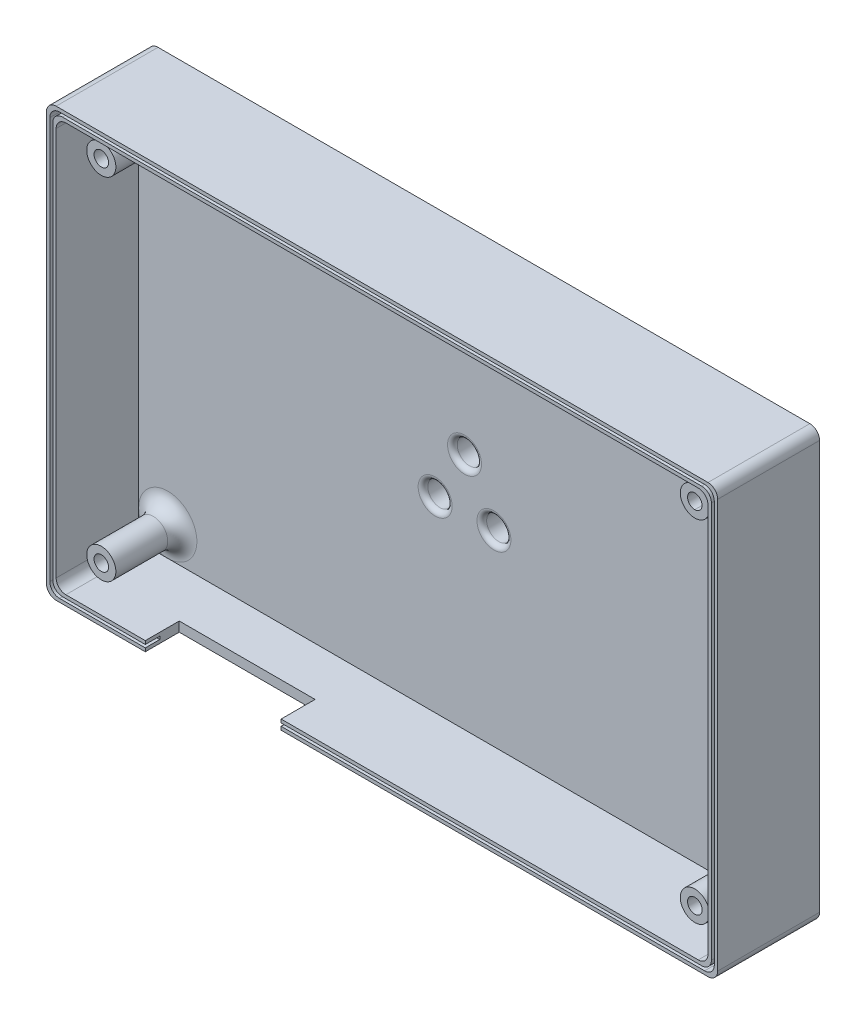
from build123d import *

# Parameters (mm, degrees)
SZKIC2_W                                   = 138.377616904
SZKIC2_H                                   = 88.232378654
DODANIE_WYCI_GNI_CIE1_DEPTH                = 4
WYTNIJ_WYCI_GNI_CIE1_DEPTH                 = 2
SZKIC4_W                                   = 138.377616904
SZKIC4_H                                   = 88.232378654
SZKIC4_W_2                                 = 134.377616904
SZKIC4_H_2                                 = 84.232378654
WYCI_GNI_CIE_CIENKA_CIANKA1_DEPTH          = 17
SZKIC2_5_R                                 = 1.492872888
SZKIC2_5_R_2                               = 1.482348965
SZKIC2_5_R_3                               = 1.507070184
WYTNIJ_WYCI_GNI_CIE3_DEPTH                 = 15
DODANIE_WYCI_GNI_CIE2_OUTLINE_R            = 3
DODANIE_WYCI_GNI_CIE2_OUTLINE_R_2          = 1.507070184
DODANIE_WYCI_GNI_CIE2_OUTLINE_R_3          = 1.492872888
DODANIE_WYCI_GNI_CIE2_DEPTH                = 13.7
SZKIC6_W                                   = 136.977616904
SZKIC6_H                                   = 86.832378654
SZKIC6_W_2                                 = 135.777616904
SZKIC6_H_2                                 = 85.632378654
WYCI_CIE_WYCI_GNI_CIE_CIENKA_CIANKA1_DEPTH = 3
ZAOKR_GLENIE1_R                            = 3
ZAOKR_GLENIE2_R                            = 2
SZKIC8_R                                   = 2.5
WYTNIJ_WYCI_GNI_CIE4_DEPTH                 = 451.2299015
DODANIE_WYCI_GNI_CIE3_START                = -4
SZKIC8_3_R                                 = 13
SZKIC8_3_R_2                               = 2.5
DODANIE_WYCI_GNI_CIE3_DEPTH                = 3
ZAOKR_GLENIE3_R                            = 1.5
ZAOKR_GLENIE4_R                            = 1
WYTNIJ_WYCI_GNI_CIE5_START                 = 10
SZKIC10_W                                  = 28
SZKIC10_H                                  = 13.675297862
WYTNIJ_WYCI_GNI_CIE5_DEPTH                 = 441.2299015


# Read off the part's stored shape, not the designer's step: Dodanie-wyciągnięcie2
with BuildPart() as part:
    # Szkic2 → Dodanie-wyciągnięcie1 (new body)
    with BuildSketch(Plane.XY):
        with Locations((-255.799797678, 267.011389153)):
            Rectangle(SZKIC2_W, SZKIC2_H)
    extrude(amount=DODANIE_WYCI_GNI_CIE1_DEPTH)

    # Szkic2<4> → Wytnij-wyciągnięcie1 (cut)
    with BuildSketch(Plane.XY):
        Polygon((-196.238801669, 233.706863015), (-193.005640162, 233.706863015), (-191.389059408, 230.906863015), (-193.005640162, 228.106863015), (-196.238801669, 228.106863015), (-197.855382423, 230.906863015), align=None)
        Polygon((-318.593699386, 305.915988479), (-320.21028014, 303.115988479), (-318.593699386, 300.315988479), (-315.360537879, 300.315988479), (-313.743957125, 303.115988479), (-315.360537879, 305.915988479), align=None)
        Polygon((-318.593699386, 233.706863015), (-320.21028014, 230.906863015), (-318.593699386, 228.106863015), (-315.360537879, 228.106863015), (-313.743957125, 230.906863015), (-315.360537879, 233.706863015), align=None)
        Polygon((-196.238801669, 305.915988479), (-193.005640162, 305.915988479), (-191.389059408, 303.115988479), (-193.005640162, 300.315988479), (-196.238801669, 300.315988479), (-197.855382423, 303.115988479), align=None)
    extrude(amount=WYTNIJ_WYCI_GNI_CIE1_DEPTH, mode=Mode.SUBTRACT)

    # Szkic4 → Wyciągnięcie-cienka ścianka1 (add)
    with BuildSketch(Plane.XY.offset(4)):
        with Locations((-255.799797678, 267.011389153)):
            Rectangle(SZKIC4_W, SZKIC4_H)
        with Locations((-255.799797678, 267.011389153)):
            Rectangle(SZKIC4_W_2, SZKIC4_H_2, mode=Mode.SUBTRACT)
    extrude(amount=WYCI_GNI_CIE_CIENKA_CIANKA1_DEPTH)

    # Szkic2<5> → Wytnij-wyciągnięcie3 (cut)
    with BuildSketch(Plane.XY):
        with Locations(Location((-316.977118633, 303.115988479, 0), (0, 0, 180))):
            Circle(SZKIC2_5_R)
        with Locations(Location((-316.977118633, 230.906863015, 0), (0, 0, 180))):
            Circle(SZKIC2_5_R_2)
        with Locations(Location((-194.622725918, 230.906863015, 0), (0, 0, 180))):
            Circle(SZKIC2_5_R_3)
        with Locations(Location((-194.622220915, 303.115988479, 0), (0, 0, 180))):
            Circle(SZKIC2_5_R)
    extrude(amount=WYTNIJ_WYCI_GNI_CIE3_DEPTH, mode=Mode.SUBTRACT)

    # Dodanie-wyciągnięcie2 outline → Dodanie-wyciągnięcie2 (add)
    # profile 1 of 4: a face of its own
    with BuildSketch(Plane.XY.offset(4)):
        with Locations((-194.622476723, 230.906789826)):
            Circle(DODANIE_WYCI_GNI_CIE2_OUTLINE_R)
        with Locations((-194.622725918, 230.906863015)):
            Circle(DODANIE_WYCI_GNI_CIE2_OUTLINE_R_2, mode=Mode.SUBTRACT)
    # profile 2 of 4: a face of its own
    with BuildSketch(Plane.XY.offset(4)):
        with Locations((-194.622476723, 303.115988479)):
            Circle(DODANIE_WYCI_GNI_CIE2_OUTLINE_R)
        with BuildLine():
            ThreePointArc((-194.622348819, 304.608861362), (-193.129348027, 303.115988479), (-194.622348819, 301.623115596))
            ThreePointArc((-194.622348819, 301.623115596), (-196.115349611, 303.11598848), (-194.622348819, 304.608861362))
        make_face(mode=Mode.SUBTRACT)
    # profile 3 of 4: a face of its own
    with BuildSketch(Plane.XY.offset(4)):
        with Locations((-316.977118633, 303.115988479)):
            Circle(DODANIE_WYCI_GNI_CIE2_OUTLINE_R)
        with Locations((-316.977118633, 303.115988479)):
            Circle(DODANIE_WYCI_GNI_CIE2_OUTLINE_R_3, mode=Mode.SUBTRACT)
    # profile 4 of 4: a face of its own
    with BuildSketch(Plane.XY.offset(4)):
        with Locations((-316.977118633, 230.906789826)):
            Circle(DODANIE_WYCI_GNI_CIE2_OUTLINE_R)
        with Locations((-316.977118633, 230.906789826)):
            Circle(DODANIE_WYCI_GNI_CIE2_OUTLINE_R_3, mode=Mode.SUBTRACT)
    extrude(amount=DODANIE_WYCI_GNI_CIE2_DEPTH)

    # Szkic6 → Wycięcie-wyciągnięcie-cienka ścianka1 (cut)
    with BuildSketch(Plane.XY.offset(21)):
        with Locations((-255.799797678, 267.011389153)):
            Rectangle(SZKIC6_W, SZKIC6_H)
        with Locations((-255.799797678, 267.011389153)):
            Rectangle(SZKIC6_W_2, SZKIC6_H_2, mode=Mode.SUBTRACT)
    extrude(amount=-WYCI_CIE_WYCI_GNI_CIE_CIENKA_CIANKA1_DEPTH, mode=Mode.SUBTRACT)

    # Zaokrąglenie1
    zaokr_glenie1_edges = [part.edges().sort_by_distance(p)[0] for p in [
        (-319.977118633, 303.115988479, 4),
        (-197.622476723, 230.906789826, 4),
        (-197.622476723, 303.115988479, 4),
        (-319.977118633, 230.906789826, 4),
    ]]
    fillet(zaokr_glenie1_edges, radius=ZAOKR_GLENIE1_R)

    # Zaokrąglenie2
    zaokr_glenie2_edges = [part.edges().sort_by_distance(p)[0] for p in [
        (-324.28860613, 223.595199826, 19.5),
        (-324.28860613, 310.42757848, 19.5),
        (-187.310989226, 310.42757848, 19.5),
        (-187.310989226, 223.595199826, 19.5),
        (-323.68860613, 309.82757848, 19.5),
        (-187.910989226, 309.82757848, 19.5),
        (-187.910989226, 224.195199826, 19.5),
        (-323.68860613, 224.195199826, 19.5),
        (-324.98860613, 311.12757848, 10.5),
        (-324.98860613, 222.895199826, 10.5),
        (-186.610989226, 222.895199826, 10.5),
        (-186.610989226, 311.12757848, 10.5),
        (-322.98860613, 224.895199826, 12.5),
        (-188.610989226, 224.895199826, 12.5),
        (-188.610989226, 309.12757848, 12.5),
        (-322.98860613, 309.12757848, 12.5),
    ]]
    fillet(zaokr_glenie2_edges, radius=ZAOKR_GLENIE2_R)

    # Szkic8 → Wytnij-wyciągnięcie4 (cut, through all)
    with BuildSketch(Plane.XY.offset(4)):
        with Locations((-261.861975505, 263.511389153)):
            Circle(SZKIC8_R)
        with Locations((-249.737619852, 263.511389153)):
            Circle(SZKIC8_R)
        with Locations((-255.799797678, 274.011389153)):
            Circle(SZKIC8_R)
    extrude(amount=-WYTNIJ_WYCI_GNI_CIE4_DEPTH, mode=Mode.SUBTRACT)

    # Szkic8<3> → Dodanie-wyciągnięcie3 (add)
    with BuildSketch(Plane.XY.offset(4).offset(DODANIE_WYCI_GNI_CIE3_START)):
        with Locations(Location((-255.799797678, 267.011389153, 0), (0, 0, 180))):
            Circle(SZKIC8_3_R)
        with Locations((-261.861975505, 263.511389153)):
            Circle(SZKIC8_3_R_2, mode=Mode.SUBTRACT)
        with Locations((-249.737619852, 263.511389153)):
            Circle(SZKIC8_3_R_2, mode=Mode.SUBTRACT)
        with Locations((-255.799797678, 274.011389153)):
            Circle(SZKIC8_3_R_2, mode=Mode.SUBTRACT)
    extrude(amount=-DODANIE_WYCI_GNI_CIE3_DEPTH)

    # Zaokrąglenie3
    zaokr_glenie3_edges = [part.edges().sort_by_distance(p)[0] for p in [
        (-242.799797678, 267.011389153, -3),
        (-242.799797678, 267.011389153, 0),
    ]]
    fillet(zaokr_glenie3_edges, radius=ZAOKR_GLENIE3_R - 0.0001)  # a hair under: the kernel refuses the full size

    # Zaokrąglenie4
    zaokr_glenie4_edges = [part.edges().sort_by_distance(p)[0] for p in [
        (-258.299797678, 274.011389153, 4),
        (-264.361975505, 263.511389153, 4),
        (-252.237619852, 263.511389153, 4),
    ]]
    fillet(zaokr_glenie4_edges, radius=ZAOKR_GLENIE4_R)

    # Szkic10 → Wytnij-wyciągnięcie5 (cut, through all)
    with BuildSketch(Plane.XY.offset(4).offset(WYTNIJ_WYCI_GNI_CIE5_START)):
        with Locations((-290.610989226, 225.130789449)):
            Rectangle(SZKIC10_W, SZKIC10_H)
    extrude(amount=WYTNIJ_WYCI_GNI_CIE5_DEPTH, mode=Mode.SUBTRACT)


solid = part.part
